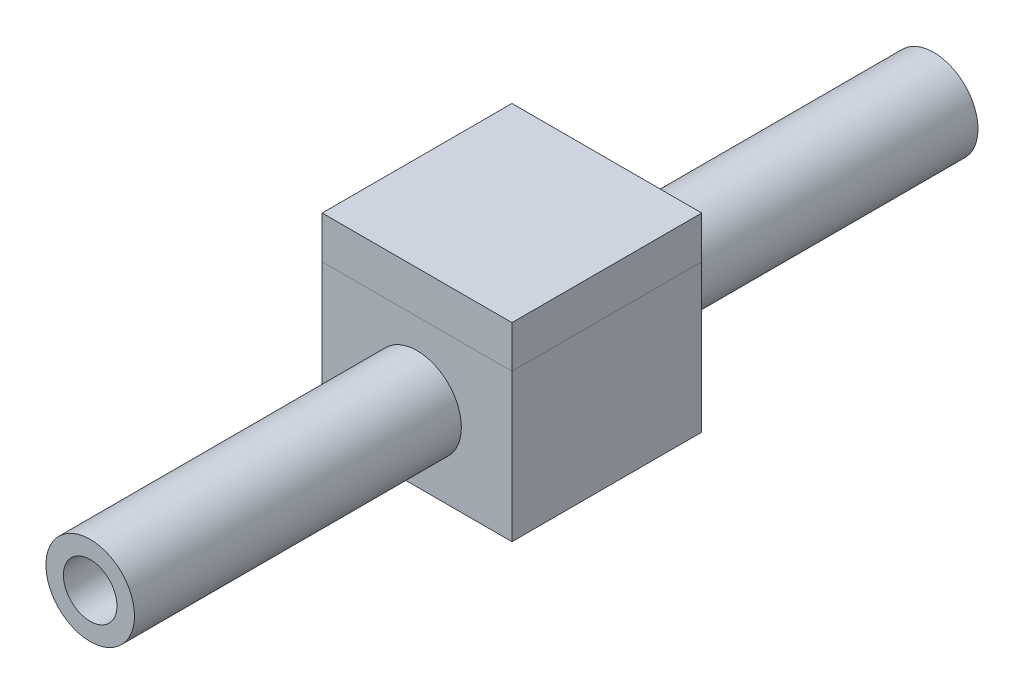
from build123d import *
from build123d.topology import SkipClean

# Parameters (mm, degrees)
SKETCH2_W           = 45
SKETCH2_H           = 35
BOSS_EXTRUDE1_DEPTH = 45
SKETCH2_4_W         = 45
SKETCH2_4_H         = 10
BOSS_EXTRUDE3_DEPTH = 45
SKETCH3_R           = 6.35
CUT_EXTRUDE2_DEPTH  = 45
SKETCH5_R           = 10.5
BOSS_EXTRUDE4_DEPTH = 77.5
CUT_EXTRUDE4_START  = 77.5
SKETCH7_R           = 6.35
CUT_EXTRUDE4_DEPTH  = 77.5
BOSS_EXTRUDE5_START = 77.5
SKETCH8_R           = 10.5
BOSS_EXTRUDE5_DEPTH = 77.5
CUT_EXTRUDE5_START  = -77.5
SKETCH9_R           = 6.35
CUT_EXTRUDE5_DEPTH  = 77.5


with BuildPart() as part:
    # Sketch2 → Boss-Extrude1 (new body)
    with BuildSketch(Plane.XY):
        Rectangle(SKETCH2_W, SKETCH2_H)
    extrude(amount=BOSS_EXTRUDE1_DEPTH)

    # Sketch3 → Cut-Extrude2 (cut)
    with BuildSketch(Plane.XY):
        Circle(SKETCH3_R)
    extrude(amount=CUT_EXTRUDE2_DEPTH, mode=Mode.SUBTRACT)

    # Sketch5 → Boss-Extrude4 (add)
    with BuildSketch(Plane.XY):
        Circle(SKETCH5_R)
    extrude(amount=-BOSS_EXTRUDE4_DEPTH)

    # Sketch7 → Cut-Extrude4 (cut)
    with SkipClean():  # the faces are left unmerged after this step: merging them gives an invalid solid
        with BuildSketch(Plane(origin=(0, 0, 0), x_dir=(-1, 0, 0), z_dir=(0, 0, -1)).offset(CUT_EXTRUDE4_START)):
            Circle(SKETCH7_R)
        extrude(amount=-CUT_EXTRUDE4_DEPTH, mode=Mode.SUBTRACT)

    # Sketch8 → Boss-Extrude5 (add)
    with BuildSketch(Plane.XY.offset(45).offset(BOSS_EXTRUDE5_START)):
        Circle(SKETCH8_R)
    extrude(amount=-BOSS_EXTRUDE5_DEPTH)

    # Sketch9 → Cut-Extrude5 (cut)
    with BuildSketch(Plane.XY.offset(122.5).offset(CUT_EXTRUDE5_START)):
        Circle(SKETCH9_R)
    extrude(amount=CUT_EXTRUDE5_DEPTH, mode=Mode.SUBTRACT)


with BuildPart() as body_2:
    # Sketch2<4> → Boss-Extrude3 (new body)
    with BuildSketch(Plane.XY):
        with Locations((0, 22.5)):
            Rectangle(SKETCH2_4_W, SKETCH2_4_H)
    extrude(amount=BOSS_EXTRUDE3_DEPTH)


solid = Compound([part.part, body_2.part])
